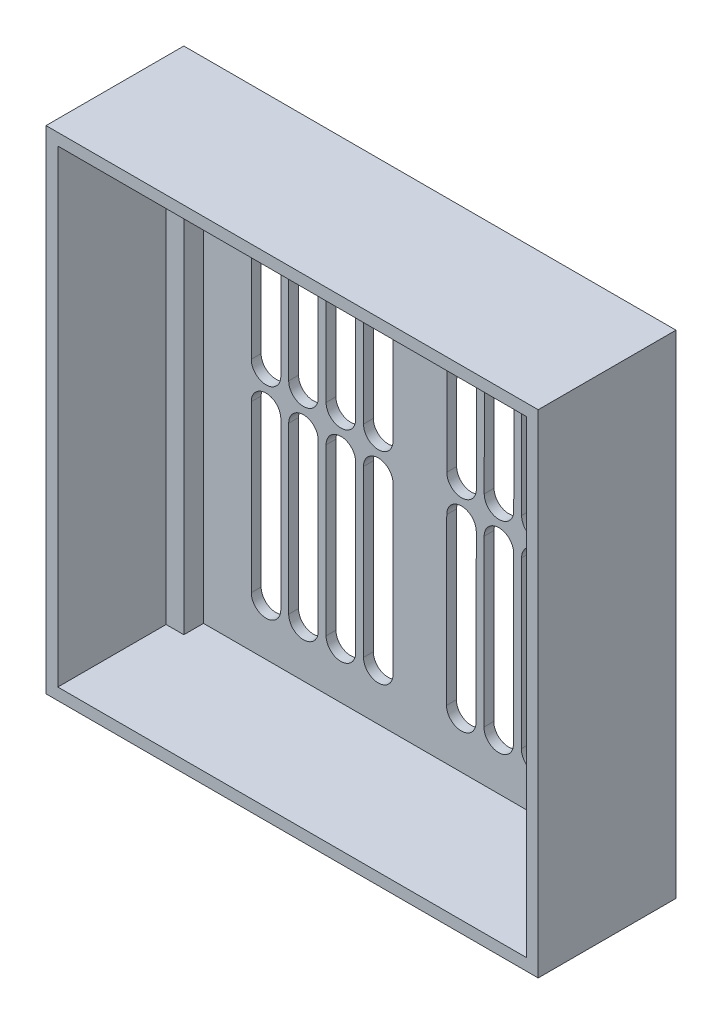
from build123d import *

# Parameters (mm, degrees)
ESBO_O1_W                = 250
ESBO_O1_H                = 250
RESSALTO_EXTRUS_O1_DEPTH = 70
ESBO_O2_W                = 238
ESBO_O2_H                = 238
CORTE_EXTRUS_O1_DEPTH    = 55
CORTE_EXTRUS_O2_DEPTH    = 340.168183978
ESBO_O7_W                = 220
ESBO_O7_H                = 229
CORTE_EXTRUS_O3_DEPTH    = 10


with BuildPart() as part:
    # Esboço1 → Ressalto-extrusão1 (new body)
    with BuildSketch(Plane.XY):
        with Locations((108.430425713, 114.833887043)):
            Rectangle(ESBO_O1_W, ESBO_O1_H)
    extrude(amount=RESSALTO_EXTRUS_O1_DEPTH)

    # Esboço2 → Corte-extrusão1 (cut)
    with BuildSketch(Plane.XY.offset(70)):
        with Locations((108.430425713, 114.833887043)):
            Rectangle(ESBO_O2_W, ESBO_O2_H)
    extrude(amount=-CORTE_EXTRUS_O1_DEPTH, mode=Mode.SUBTRACT)

    # Esboço6 → Corte-extrusão2 (cut, through all)
    with BuildSketch(Plane.XY.offset(15)):
        with BuildLine():
            Line((22.695507498, 208.167609342), (22.695507498, 124.153986831))
            ThreePointArc((22.695507498, 124.153986831), (30.195507498, 116.653986831), (37.695507498, 124.153986831))
            Line((37.695507498, 124.153986831), (37.695507498, 208.167609342))
            ThreePointArc((37.695507498, 208.167609342), (30.195507498, 215.667609342), (22.695507498, 208.167609342))
        make_face()
        with BuildLine():
            Line((41.695507498, 208.167609342), (41.695507498, 124.153986831))
            ThreePointArc((41.695507498, 124.153986831), (49.195507498, 116.653986831), (56.695507498, 124.153986831))
            Line((56.695507498, 124.153986831), (56.695507498, 208.167609342))
            ThreePointArc((56.695507498, 208.167609342), (49.195507498, 215.667609342), (41.695507498, 208.167609342))
        make_face()
        with BuildLine():
            Line((60.695507498, 208.167609342), (60.695507498, 124.153986831))
            ThreePointArc((60.695507498, 124.153986831), (68.195507498, 116.653986831), (75.695507498, 124.153986831))
            Line((75.695507498, 124.153986831), (75.695507498, 208.167609342))
            ThreePointArc((75.695507498, 208.167609342), (68.195507498, 215.667609342), (60.695507498, 208.167609342))
        make_face()
        with BuildLine():
            Line((79.695507498, 208.167609342), (79.695507498, 124.153986831))
            ThreePointArc((79.695507498, 124.153986831), (87.195507498, 116.653986831), (94.695507498, 124.153986831))
            Line((94.695507498, 124.153986831), (94.695507498, 208.167609342))
            ThreePointArc((94.695507498, 208.167609342), (87.195507498, 215.667609342), (79.695507498, 208.167609342))
        make_face()
        with BuildLine():
            Line((94.695507498, 105.513787255), (94.695507498, 21.500164744))
            ThreePointArc((94.695507498, 21.500164744), (87.195507498, 14.000164744), (79.695507498, 21.500164744))
            Line((79.695507498, 21.500164744), (79.695507498, 105.513787255))
            ThreePointArc((79.695507498, 105.513787255), (87.195507498, 113.013787255), (94.695507498, 105.513787255))
        make_face()
        with BuildLine():
            Line((75.695507498, 105.513787255), (75.695507498, 21.500164744))
            ThreePointArc((75.695507498, 21.500164744), (68.195507498, 14.000164744), (60.695507498, 21.500164744))
            Line((60.695507498, 21.500164744), (60.695507498, 105.513787255))
            ThreePointArc((60.695507498, 105.513787255), (68.195507498, 113.013787255), (75.695507498, 105.513787255))
        make_face()
        with BuildLine():
            Line((56.695507498, 105.513787256), (56.695507498, 21.500164744))
            ThreePointArc((56.695507498, 21.500164744), (49.195507498, 14.000164744), (41.695507498, 21.500164744))
            Line((41.695507498, 21.500164744), (41.695507498, 105.513787256))
            ThreePointArc((41.695507498, 105.513787256), (49.195507498, 113.013787256), (56.695507498, 105.513787256))
        make_face()
        with BuildLine():
            Line((37.695507498, 21.500164744), (37.695507498, 105.513787256))
            ThreePointArc((37.695507498, 105.513787256), (30.195507498, 113.013787256), (22.695507498, 105.513787256))
            Line((22.695507498, 105.513787256), (22.695507498, 21.500164744))
            ThreePointArc((22.695507498, 21.500164744), (30.195507498, 14.000164744), (37.695507498, 21.500164744))
        make_face()
        with BuildLine():
            Line((193.875104062, 21.383203899), (193.989910965, 105.396747967))
            ThreePointArc((193.989910965, 105.396747967), (186.500166922, 112.906989919), (178.989924971, 105.417245876))
            Line((178.989924971, 105.417245876), (178.875118068, 21.403701808))
            ThreePointArc((178.875118068, 21.403701808), (186.36486211, 13.893459856), (193.875104062, 21.383203899))
        make_face()
        with BuildLine():
            Line((174.875121802, 21.409167917), (174.989928706, 105.422711985))
            ThreePointArc((174.989928706, 105.422711985), (167.500184663, 112.932953936), (159.989942711, 105.443209893))
            Line((159.989942711, 105.443209893), (159.875135808, 21.429665825))
            ThreePointArc((159.875135808, 21.429665825), (167.364879851, 13.919423874), (174.875121802, 21.409167917))
        make_face()
        with BuildLine():
            Line((155.875139543, 21.435131934), (155.989946446, 105.448676002))
            ThreePointArc((155.989946446, 105.448676002), (148.500202403, 112.958917953), (140.989960451, 105.46917391))
            Line((140.989960451, 105.46917391), (140.875153548, 21.455629843))
            ThreePointArc((140.875153548, 21.455629843), (148.364897591, 13.945387891), (155.875139543, 21.435131934))
        make_face()
        with BuildLine():
            Line((136.875157283, 21.461095951), (136.989964186, 105.474640019))
            ThreePointArc((136.989964186, 105.474640019), (129.500220143, 112.984881971), (121.989978192, 105.495137928))
            Line((121.989978192, 105.495137928), (121.875171288, 21.48159386))
            ThreePointArc((121.875171288, 21.48159386), (129.364915331, 13.971351908), (136.875157283, 21.461095951))
        make_face()
        with BuildLine():
            Line((122.015450532, 124.135320099), (122.130257436, 208.148864167))
            ThreePointArc((122.130257436, 208.148864167), (129.640499387, 215.63860821), (137.13024343, 208.128366259))
            Line((137.13024343, 208.128366259), (137.015436527, 124.114822191))
            ThreePointArc((137.015436527, 124.114822191), (129.505194575, 116.625078148), (122.015450532, 124.135320099))
        make_face()
        with BuildLine():
            Line((141.015432792, 124.109356082), (141.130239695, 208.122900149))
            ThreePointArc((141.130239695, 208.122900149), (148.640481647, 215.612644192), (156.13022569, 208.102402241))
            Line((156.13022569, 208.102402241), (156.015418786, 124.088858173))
            ThreePointArc((156.015418786, 124.088858173), (148.505176835, 116.59911413), (141.015432792, 124.109356082))
        make_face()
        with BuildLine():
            Line((160.015415052, 124.083392064), (160.130221955, 208.096936132))
            ThreePointArc((160.130221955, 208.096936132), (167.640463907, 215.586680175), (175.13020795, 208.076438223))
            Line((175.13020795, 208.076438223), (175.015401046, 124.062894155))
            ThreePointArc((175.015401046, 124.062894155), (167.505159095, 116.573150112), (160.015415052, 124.083392064))
        make_face()
        with BuildLine():
            Line((179.130204215, 208.070972114), (179.015397311, 124.057428046))
            ThreePointArc((179.015397311, 124.057428046), (186.505141354, 116.547186095), (194.015383306, 124.036930138))
            Line((194.015383306, 124.036930138), (194.130190209, 208.050474206))
            ThreePointArc((194.130190209, 208.050474206), (186.640446166, 215.560716157), (179.130204215, 208.070972114))
        make_face()
    extrude(amount=-CORTE_EXTRUS_O2_DEPTH, mode=Mode.SUBTRACT)

    # Esboço7 → Corte-extrusão3 (cut)
    with BuildSketch(Plane.XY.offset(15)):
        with Locations((108.430425713, 110.333887043)):
            Rectangle(ESBO_O7_W, ESBO_O7_H)
    extrude(amount=-CORTE_EXTRUS_O3_DEPTH, mode=Mode.SUBTRACT)


solid = part.part
